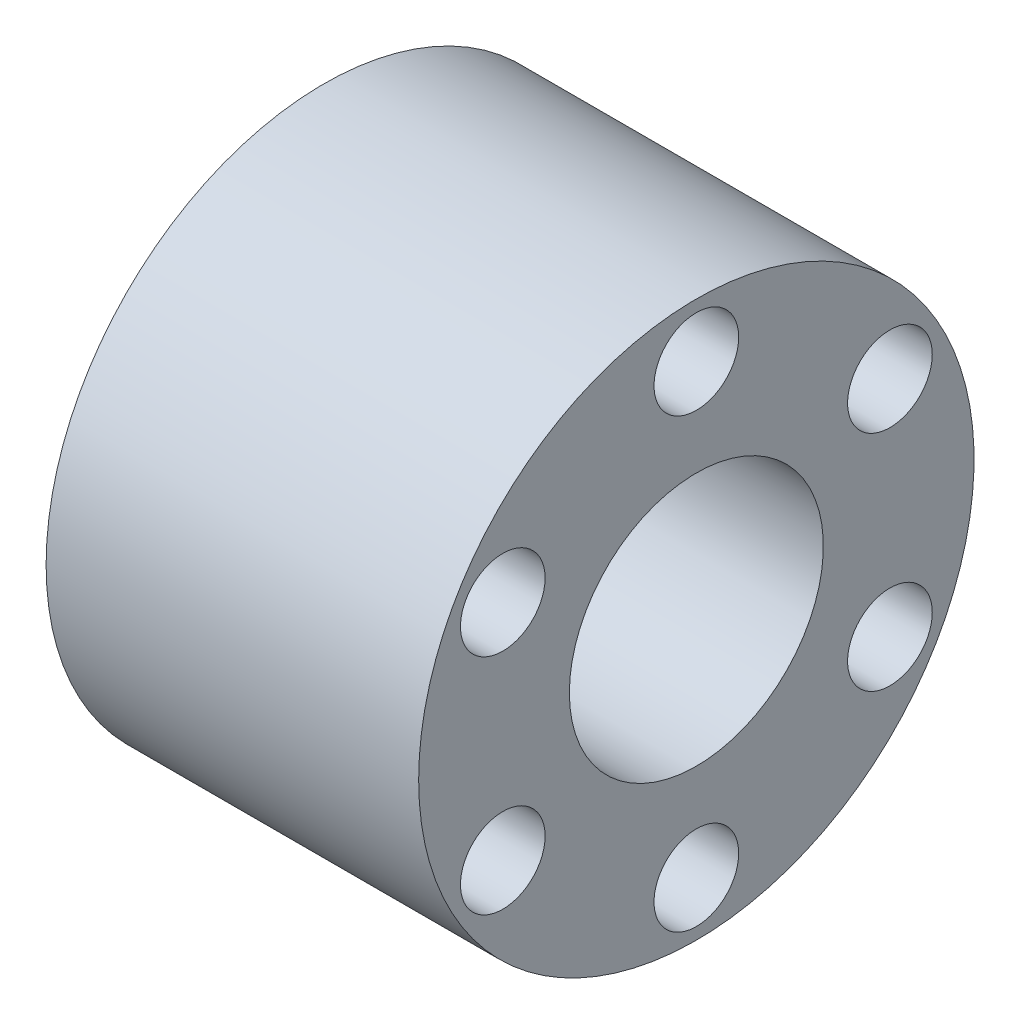
from build123d import *

# Parameters (mm, degrees)
SKETCH1_R           = 10.414
SKETCH1_R_2         = 4.7625
BOSS_EXTRUDE1_DEPTH = 7.62
BOSS_EXTRUDE2_START = 6.35
SKETCH2_R           = 10.414
SKETCH2_R_2         = 6.35
BOSS_EXTRUDE2_DEPTH = 6.35
SKETCH3_R           = 1.5875
CUT_EXTRUDE1_DEPTH  = 21.299352009


with BuildPart() as part:
    # Sketch1 → Boss-Extrude1 (new body)
    with BuildSketch(Plane(origin=(0, 0, 0), x_dir=(0, 0, -1), z_dir=(1, 0, 0))):
        Circle(SKETCH1_R)
        Circle(SKETCH1_R_2, mode=Mode.SUBTRACT)
    extrude(amount=BOSS_EXTRUDE1_DEPTH)

    # Sketch2 → Boss-Extrude2 (add)
    with BuildSketch(Plane.ZY.offset(BOSS_EXTRUDE2_START)):
        Circle(SKETCH2_R)
        Circle(SKETCH2_R_2, mode=Mode.SUBTRACT)
    extrude(amount=-BOSS_EXTRUDE2_DEPTH)

    # Sketch3 → Cut-Extrude1 (cut, through all)
    with BuildSketch(Plane(origin=(7.62, 0, 0), x_dir=(0, 0, -1), z_dir=(1, 0, 0))):
        with Locations((0, 8.382)):
            Circle(SKETCH3_R)
        with Locations((7.259024935, 4.191)):
            Circle(SKETCH3_R)
        with Locations((7.259024935, -4.191)):
            Circle(SKETCH3_R)
        with Locations((0, -8.382)):
            Circle(SKETCH3_R)
        with Locations((-7.259024935, -4.191)):
            Circle(SKETCH3_R)
        with Locations((-7.259024935, 4.191)):
            Circle(SKETCH3_R)
    extrude(amount=-CUT_EXTRUDE1_DEPTH, mode=Mode.SUBTRACT)


solid = part.part
